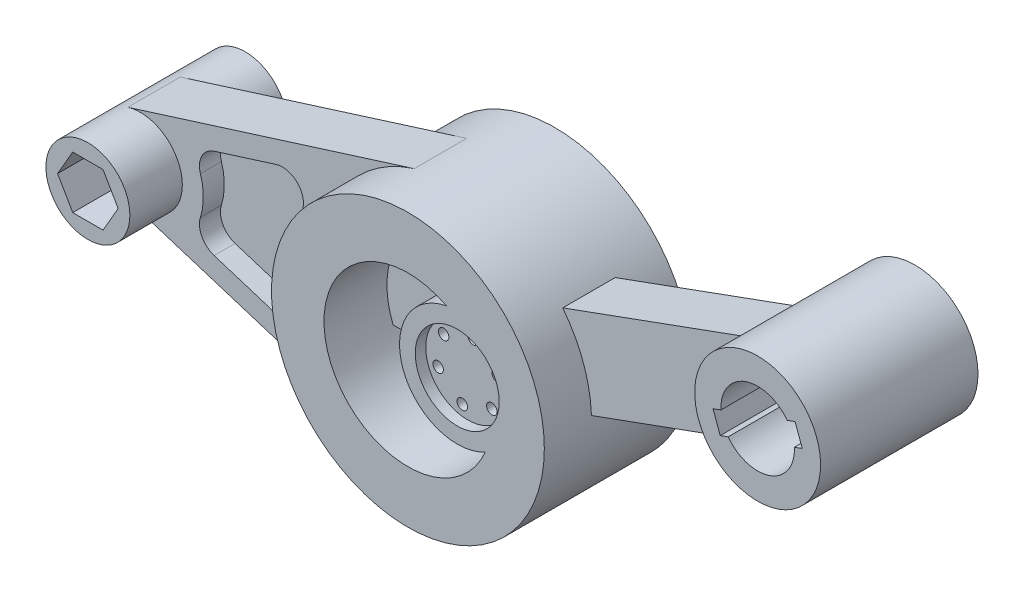
from build123d import *
from build123d.topology import SkipClean

# Parameters (mm, degrees)
LEFT_ARM_DEPTH                = 12.5
SKETCH2_R                     = 20
LEFT_BOSS_DEPTH               = 37.5
LEFT_HEX_DEPTH                = 237.801604724
LEFT_HEX_DEPTH_BACK           = 237.801604724
SKETCH3_R                     = 65
CENTRE_BOSS_DEPTH             = 35
SKETCH5_W                     = 25
SKETCH5_H                     = 40
RIGHT_ARM_DEPTH               = 180
SKETCH7_R                     = 30
RIGHT_BOSS_DEPTH              = 37.5
SKETCH8_R                     = 17.5
RIGHT_BOSS_HOLE_DEPTH         = 369.660954503
SKETCH9_R                     = 40
CENTRE_HOLE_DEPTH             = 369.160494044
SKETCH10_R                    = 27.5
CENTRE_BLOB_DEPTH             = 35
CENTRE_BEAM_REACH             = 224.371
SKETCH11_W                    = 10
SKETCH11_H                    = 30
CENTRE_BEAM_DIRECTION_2_REACH = 224.371
SKETCH12_R                    = 20
CUT_EXTRUDE4_DEPTH            = 5
M6X1_0_TAPPED_HOLE1_D         = 5
CIRPATTERN1_COUNT             = 6
CUT_OUT_DEPTH                 = 10
FILLET1_R                     = 10
FILLET1_OF_MIRROR2_R          = 10
KEYWAY_DEPTH                  = 363.894129706


with BuildPart() as part:
    # Sketch1 → LEFT_ARM (new, symmetric)
    with BuildSketch(Plane.XY):
        with BuildLine():
            Line((-6, 19.078784028), (130.5, 62.006048092))
            ThreePointArc((130.5, 62.006048092), (215, 0), (130.5, -62.006048092))
            Line((130.5, -62.006048092), (-6, -19.078784028))
            ThreePointArc((-6, -19.078784028), (-20, 0), (-6, 19.078784028))
        make_face()
    extrude(amount=LEFT_ARM_DEPTH, both=True)

    # Sketch2 → LEFT_Boss (add, symmetric)
    with SkipClean():  # the faces are left unmerged after this step: merging them gives an invalid solid
        with BuildSketch(Plane.XY):
            Circle(SKETCH2_R)
        extrude(amount=LEFT_BOSS_DEPTH, both=True)

    # Sketch4 → LEFT_Hex (cut, two sides: drawn at the far end of the back side and taken through both)
    with SkipClean():  # the faces are left unmerged after this step: merging them gives an invalid solid
        with BuildSketch(Plane.XY.offset(37.5).offset(-LEFT_HEX_DEPTH_BACK)):
            Polygon((14.43375673, 0), (7.216878365, 12.5), (-7.216878365, 12.5), (-14.43375673, 0), (-7.216878365, -12.5), (7.216878365, -12.5), align=None)
        extrude(amount=LEFT_HEX_DEPTH + LEFT_HEX_DEPTH_BACK, mode=Mode.SUBTRACT)

    # Sketch3 → CENTRE_Boss (add, symmetric)
    with SkipClean():  # the faces are left unmerged after this step: merging them gives an invalid solid
        with BuildSketch(Plane.XY):
            with Locations((150, 0)):
                Circle(SKETCH3_R)
        extrude(amount=CENTRE_BOSS_DEPTH, both=True)

    # Sketch5 → RIGHT_ARM (add)
    with SkipClean():  # the faces are left unmerged after this step: merging them gives an invalid solid
        with BuildSketch(Plane(origin=(132.453333234, 48.209070726, 0), x_dir=(0, 0, -1), z_dir=(0.9396926207859081, 0.34202014332566943, 0))):
            with Locations((0, -51.303021499)):
                Rectangle(SKETCH5_W, SKETCH5_H)
        extrude(amount=RIGHT_ARM_DEPTH)

    # Sketch7 → RIGHT_Boss (add, symmetric)
    with SkipClean():  # the faces are left unmerged after this step: merging them gives an invalid solid
        with BuildSketch(Plane.XY):
            with Locations((319.144671741, 61.563625799)):
                Circle(SKETCH7_R)
        extrude(amount=RIGHT_BOSS_DEPTH, both=True)
    add(part.part.scale(1), mode=Mode.REPLACE)  # the faces are merged on a copy

    # Sketch8 → RIGHT_Boss_Hole (cut, through all)
    with BuildSketch(Plane.XY.offset(37.5)):
        with Locations((319.144671741, 61.563625799)):
            Circle(SKETCH8_R)
    extrude(amount=-RIGHT_BOSS_HOLE_DEPTH, mode=Mode.SUBTRACT)

    # Sketch9 → CENTRE_Hole (cut, through all)
    with BuildSketch(Plane.XY.offset(35)):
        with Locations((150, 0)):
            Circle(SKETCH9_R)
    extrude(amount=-CENTRE_HOLE_DEPTH, mode=Mode.SUBTRACT)

    # Sketch10 → CENTRE_Blob (add, symmetric)
    with SkipClean():  # the faces are left unmerged after this step: merging them gives an invalid solid
        with BuildSketch(Plane.XY):
            with Locations((173.49231552, 8.550503583)):
                Circle(SKETCH10_R)
        extrude(amount=CENTRE_BLOB_DEPTH, both=True)

    # Sketch11 → CENTRE_Beam (add, up to next)
    with BuildSketch(Plane(origin=(150, 0, 0), x_dir=(0, 0, -1), z_dir=(1, 0, 0)), mode=Mode.PRIVATE) as centre_beam_sk1:
        Rectangle(SKETCH11_W, SKETCH11_H)
    centre_beam_tool1 = extrude(centre_beam_sk1.sketch, amount=CENTRE_BEAM_REACH, mode=Mode.PRIVATE) - part.part
    add(centre_beam_tool1.solids().sort_by_distance((150, 0, 0))[0])

    # Sketch11 → CENTRE_Beam direction 2 (add, up to next)
    with BuildSketch(Plane(origin=(150, 0, 0), x_dir=(0, 0, -1), z_dir=(1, 0, 0)), mode=Mode.PRIVATE) as centre_beam_direction_2_sk1:
        Rectangle(SKETCH11_W, SKETCH11_H)
    centre_beam_direction_2_tool1 = extrude(centre_beam_direction_2_sk1.sketch, amount=-CENTRE_BEAM_DIRECTION_2_REACH, mode=Mode.PRIVATE) - part.part
    add(centre_beam_direction_2_tool1.solids().sort_by_distance((150, 0, 0))[0])

    # Sketch12 → Cut-Extrude4 (cut)
    with BuildSketch(Plane.XY.offset(35)):
        with Locations((173.49231552, 8.550503583)):
            Circle(SKETCH12_R)
    cut_extrude4 = extrude(amount=-CUT_EXTRUDE4_DEPTH, mode=Mode.SUBTRACT)

    # M6x1.0 Tapped Hole1 (through all)
    with Locations(Plane.XY.offset(30)):
        with Locations((159.396926208, 3.420201433)):
            m6x1_0_tapped_hole1 = Hole(M6X1_0_TAPPED_HOLE1_D / 2)

    # CirPattern1: M6x1.0 Tapped Hole1 ×6 about axis
    cirpattern1_axis = Axis((173.49231552, 8.550503583, 0), (0, 0, 1))
    for i in range(1, CIRPATTERN1_COUNT):
        add(m6x1_0_tapped_hole1.rotate(cirpattern1_axis, i * 360 / CIRPATTERN1_COUNT), mode=Mode.SUBTRACT)

    # Mirror1: Cut-Extrude4 across plane
    add(cut_extrude4.mirror(Plane.XY), mode=Mode.SUBTRACT)

    # Sketch15 → Cut_OUT (cut)
    with BuildSketch(Plane.XY.offset(12.5)):
        with BuildLine():
            Line((84.858453972, 37.169597537), (23.981475126, 18.024673388))
            ThreePointArc((23.981475126, 18.024673388), (30, 0), (23.981475126, -18.024673388))
            Line((23.981475126, -18.024673388), (84.858453972, -37.169597537))
            ThreePointArc((84.858453972, -37.169597537), (75, 0), (84.858453972, 37.169597537))
        make_face()
    cut_out = extrude(amount=-CUT_OUT_DEPTH, mode=Mode.SUBTRACT)

    # Fillet1
    fillet1_edges = [part.edges().sort_by_distance(p)[0] for p in [
        (23.981475126, -18.024673388, 7.5),
        (23.981475126, 18.024673388, 7.5),
        (84.858453972, 37.169597537, 7.5),
        (84.858453972, -37.169597537, 7.5),
    ]]
    fillet(fillet1_edges, radius=FILLET1_R)

    # Mirror2: Cut_OUT across plane
    with SkipClean():  # the faces are left unmerged after this step: merging them gives an invalid solid
        add(cut_out.mirror(Plane.XY), mode=Mode.SUBTRACT)

    # Fillet1 of Mirror2
    fillet1_of_mirror2_edges = [part.edges().sort_by_distance(p)[0] for p in [
        (23.981475126, -18.024673388, -7.5),
        (23.981475126, 18.024673388, -7.5),
        (84.858453972, 37.169597537, -7.5),
        (84.858453972, -37.169597537, -7.5),
    ]]
    fillet(fillet1_of_mirror2_edges, radius=FILLET1_OF_MIRROR2_R)

    # Sketch16 → KEYWAY (cut, symmetric)
    with SkipClean():  # the faces are left unmerged after this step: merging them gives an invalid solid
        with BuildSketch(Plane.XY):
            Polygon((320.854772458, 56.865162695), (317.434571025, 66.262088903), (297.888964512, 59.148069921), (301.309165946, 49.751143714), align=None)
        keyway = extrude(amount=KEYWAY_DEPTH, both=True, mode=Mode.SUBTRACT)

    # Mirror3: KEYWAY across plane
    with SkipClean():  # the faces are left unmerged after this step: merging them gives an invalid solid
        add(keyway.mirror(Plane(origin=(301.598004975, 109.772696525, 0), x_dir=(0, 0, 1), z_dir=(0.9396926207859081, 0.34202014332566943, 0))), mode=Mode.SUBTRACT)


solid = part.part
